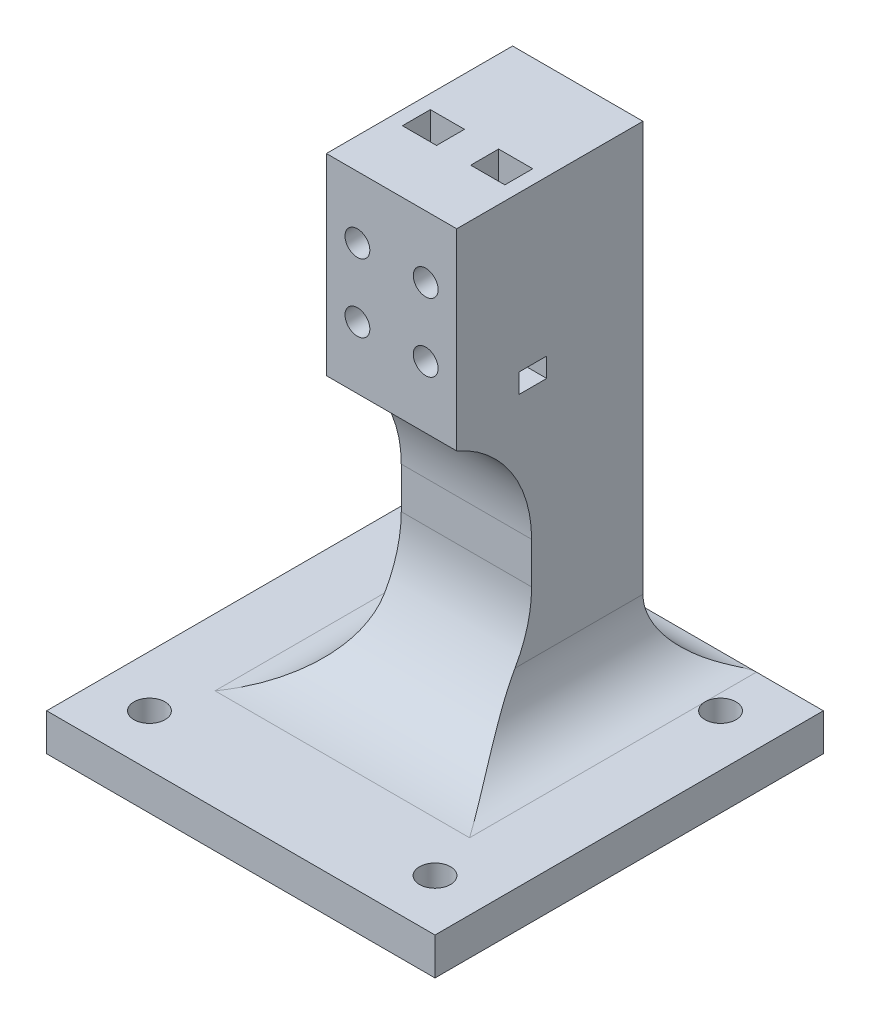
from build123d import *
from OCP.BRepAlgoAPI import BRepAlgoAPI_Cut
from OCP.TopTools import TopTools_ListOfShape

# Parameters (mm, degrees)
SKETCH1_W           = 21
SKETCH1_H           = 31
BOSS_EXTRUDE1_DEPTH = 30
SKETCH2_W           = 21
SKETCH2_H           = 17.936176812
BOSS_EXTRUDE2_DEPTH = 45
SKETCH6_R           = 2
CUT_EXTRUDE1_DEPTH  = 30
SKETCH8_W           = 62.569062922
SKETCH8_H           = 62.569062922
SKETCH8_R           = 2.5
BOSS_EXTRUDE6_DEPTH = 6
FILLET1_R           = 20
FILLET2_R           = 20
FILLET3_START       = -10.5
FILLET3_DEPTH       = 21
FILLET3_START_2     = -38.284535634
FILLET3_2_DEPTH     = 46.220712446
FILLET3_START_3     = -22
FILLET3_3_DEPTH     = 43
SKETCH9_W           = 5.5
SKETCH9_H           = 4.5
CUT_EXTRUDE2_DEPTH  = 25
SKETCH10_W          = 4.5
SKETCH10_H          = 3.134245462
CUT_EXTRUDE3_DEPTH  = 25


with BuildPart() as part:
    # Sketch1 → Boss-Extrude1 (new body)
    with BuildSketch(Plane.XY):
        Rectangle(SKETCH1_W, SKETCH1_H)
    extrude(amount=-BOSS_EXTRUDE1_DEPTH)

    # Sketch2 → Boss-Extrude2 (add)
    with BuildSketch(Plane.XZ.offset(15.5)):
        with Locations((0, -21.031911594)):
            Rectangle(SKETCH2_W, SKETCH2_H)
    extrude(amount=BOSS_EXTRUDE2_DEPTH)

    # Sketch6 → Cut-Extrude1 (cut)
    with BuildSketch(Plane.XY):
        with Locations((5.5, 5.5)):
            Circle(SKETCH6_R)
        with Locations((5.5, -5.5)):
            Circle(SKETCH6_R)
        with Locations((-5.5, -5.5)):
            Circle(SKETCH6_R)
        with Locations((-5.5, 5.5)):
            Circle(SKETCH6_R)
    extrude(amount=-CUT_EXTRUDE1_DEPTH, mode=Mode.SUBTRACT)

    # Sketch8 → Boss-Extrude6 (add)
    with BuildSketch(Plane.XZ.offset(60.5)):
        with Locations((0, -7)):
            Rectangle(SKETCH8_W, SKETCH8_H)
        with Locations(Location((23, 16, 0), (0, 0, 270))):
            Circle(SKETCH8_R, mode=Mode.SUBTRACT)
        with Locations(Location((23, -30, 0), (0, 0, 270))):
            Circle(SKETCH8_R, mode=Mode.SUBTRACT)
        with Locations(Location((-23, -30, 0), (0, 0, 270))):
            Circle(SKETCH8_R, mode=Mode.SUBTRACT)
        with Locations(Location((-23, 16, 0), (0, 0, 270))):
            Circle(SKETCH8_R, mode=Mode.SUBTRACT)
    extrude(amount=BOSS_EXTRUDE6_DEPTH)

    # Fillet1
    fillet1_edges = [part.edges().sort_by_distance(p)[0] for p in [
        (0, -60.5, -12.063823188),
    ]]
    fillet(fillet1_edges, radius=FILLET1_R)

    # Fillet2
    # the kernel refuses this fillet: 20 mm, written as the material it adds along each edge
    with BuildSketch(Plane(origin=(-10.5, -15.5, -12.063823188), x_dir=(0, 0, 1), z_dir=(1, 0, 0))) as fillet2_piece_1:
        with BuildLine():
            CenterArc((20, 18.358025428), FILLET2_R, 180, 66.621165334)
            Line((0, 18.358025428), (-0.4, 18.358025428))
            Line((-0.4, 18.358025428), (-0.4, 0))
            Line((-0.4, 0), (0, -0.4))
            ThreePointArc((0, -0.4), (6.031911594, -0.4), (11.905099651, -0.367160509))
            Line((11.905099651, -0.367160509), (12.063823188, 0))
        make_face()
    extrude(amount=21)


with BuildPart() as fillet3_tool:
    # Fillet3: read off the stored shape, not the designer's step
    # Fillet3 outline → Fillet3 (new body)
    with BuildSketch(Plane.YZ.offset(FILLET3_START)):
        with BuildLine():
            ThreePointArc((-60.5, -38.284531461), (-57.084283982, -32.34641635), (-50.648240376, -30))
            Line((-50.648240376, -30), (-60.5, -30))
            Line((-60.5, -30), (-60.5, -38.284531461))
        make_face()
    extrude(amount=FILLET3_DEPTH)


with BuildPart() as part_1:
    add(part.part)


with BuildPart() as part_2:
    # Fillet3: joined with fillet3_tool
    add(part_1.part.fuse(fillet3_tool.part, tol=0.00001))


with BuildPart() as fillet3_2_tool:
    # Fillet3 2 outline → Fillet3 2 (new body)
    with BuildSketch(Plane.XY.offset(FILLET3_START_2)):
        with BuildLine():
            Line((10.5, -50.5), (10.5, -60.5))
            Line((10.5, -60.5), (20.5, -60.5))
            ThreePointArc((20.5, -60.5), (13.428932188, -57.571067812), (10.5, -50.5))
        make_face()
        with BuildLine():
            ThreePointArc((-10.5, -50.5), (-13.428932188, -57.571067812), (-20.5, -60.5))
            Line((-20.5, -60.5), (-10.5, -60.5))
            Line((-10.5, -60.5), (-10.5, -50.5))
        make_face()
    extrude(amount=FILLET3_2_DEPTH)


with BuildPart() as part_3:
    add(part_2.part)


with BuildPart() as part_4:
    # Fillet3 2: joined with fillet3_2_tool
    add(part_3.part.fuse(fillet3_2_tool.part, tol=0.00001))


with BuildPart() as fillet3_3_tool:
    # Fillet3 3 outline → Fillet3 3 (new body)
    with BuildSketch(Plane.YZ.offset(FILLET3_START_3)):
        with BuildLine():
            ThreePointArc((-50.648240376, -30), (-57.084283982, -32.34641635), (-60.5, -38.284531461))
            Line((-60.5, -38.284531461), (-50.5, -38.284535634))
            Line((-50.5, -38.284535634), (-50.5, -30))
            Line((-50.5, -30), (-50.648240376, -30))
        make_face()
        with BuildLine():
            Line((-50.5, 7.936176812), (-60.5, 7.936176812))
            ThreePointArc((-60.5, 7.936176812), (-57.820508076, -2.063823188), (-50.5, -9.384331263))
            Line((-50.5, -9.384331263), (-50.5, 7.936176812))
        make_face()
    extrude(amount=FILLET3_3_DEPTH)


with BuildPart() as part_5:
    add(part_4.part)

    # Fillet3 3: cut by fillet3_3_tool, with a tolerance
    fillet3_3_stock = TopTools_ListOfShape()
    fillet3_3_stock.Append(part_5.part.wrapped)
    fillet3_3_tools = TopTools_ListOfShape()
    fillet3_3_tools.Append(fillet3_3_tool.part.wrapped)
    fillet3_3_cut = BRepAlgoAPI_Cut()
    fillet3_3_cut.SetArguments(fillet3_3_stock)
    fillet3_3_cut.SetTools(fillet3_3_tools)
    fillet3_3_cut.SetFuzzyValue(0.00001)
    fillet3_3_cut.Build()
    add(Compound.cast(fillet3_3_cut.Shape()).solids(), mode=Mode.REPLACE)

    # Sketch9 → Cut-Extrude2 (cut)
    with BuildSketch(Plane(origin=(0, 15.5, 0), x_dir=(1, 0, 0), z_dir=(0, 1, 0))):
        with Locations((-5.5, 12.25)):
            Rectangle(SKETCH9_W, SKETCH9_H)
        with Locations((5.5, 12.25)):
            Rectangle(SKETCH9_W, SKETCH9_H)
    extrude(amount=-CUT_EXTRUDE2_DEPTH, mode=Mode.SUBTRACT)

    # Sketch10 → Cut-Extrude3 (cut)
    with BuildSketch(Plane.ZY.offset(10.5)):
        with Locations((-12.25, -11.067122731)):
            Rectangle(SKETCH10_W, SKETCH10_H)
    extrude(amount=-CUT_EXTRUDE3_DEPTH, mode=Mode.SUBTRACT)


solid = part_5.part
